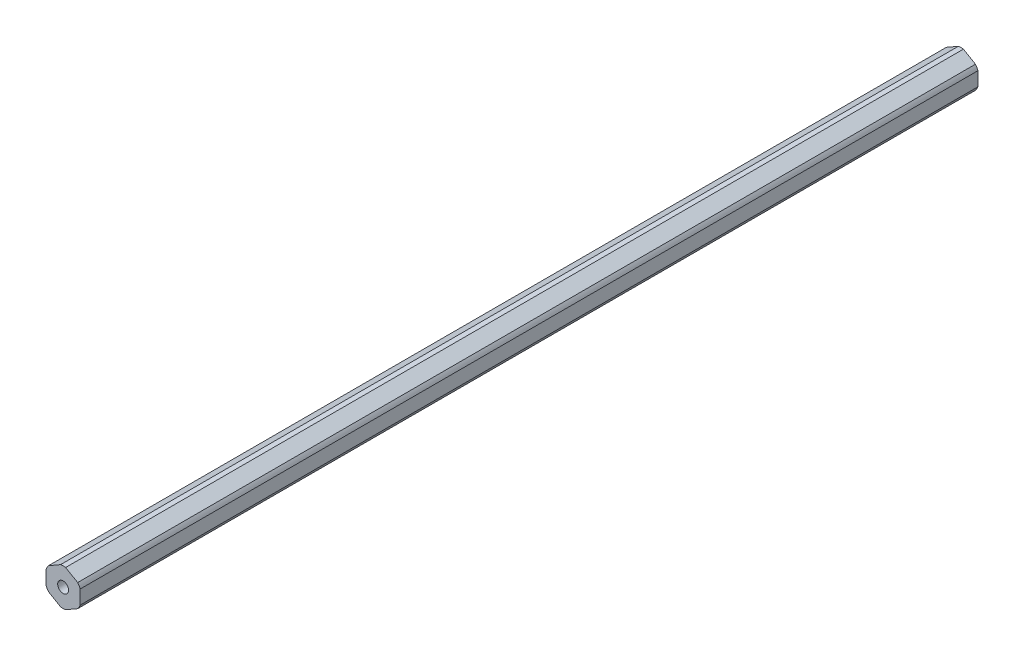
from build123d import *

# Parameters (mm, degrees)
BOSS_EXTRUDE1_DEPTH                  = 166.6875
F_10_32_TAPPED_HOLE1_D               = 4.0386
F_10_32_TAPPED_HOLE1_DEPTH           = 16.34744
F_10_32_TAPPED_HOLE1_TIP             = 1.213317848
F_10_32_TAPPED_HOLE1_ON_FACE_2_D     = 4.0386
F_10_32_TAPPED_HOLE1_ON_FACE_2_DEPTH = 16.34744
F_10_32_TAPPED_HOLE1_ON_FACE_2_TIP   = 1.213317848


with BuildPart() as part:
    # Sketch1 → Boss-Extrude1 (new, symmetric)
    with BuildSketch(Plane.XY):
        with BuildLine():
            ThreePointArc((0.93173274, 6.79441227), (0, 6.858), (-0.93173274, 6.79441227))
            Line((-0.93173274, 6.79441227), (-5.41826726, 4.204110358))
            ThreePointArc((-5.41826726, 4.204110358), (-5.939202219, 3.429), (-6.35, 2.590301913))
            Line((-6.35, 2.590301913), (-6.35, -2.590301913))
            ThreePointArc((-6.35, -2.590301913), (-5.939202219, -3.429), (-5.41826726, -4.204110358))
            Line((-5.41826726, -4.204110358), (-0.93173274, -6.79441227))
            ThreePointArc((-0.93173274, -6.79441227), (0, -6.858), (0.93173274, -6.79441227))
            Line((0.93173274, -6.79441227), (5.41826726, -4.204110358))
            ThreePointArc((5.41826726, -4.204110358), (5.939202219, -3.429), (6.35, -2.590301913))
            Line((6.35, -2.590301913), (6.35, 2.590301913))
            ThreePointArc((6.35, 2.590301913), (5.939202219, 3.429), (5.41826726, 4.204110358))
            Line((5.41826726, 4.204110358), (0.93173274, 6.79441227))
        make_face()
    extrude(amount=BOSS_EXTRUDE1_DEPTH, both=True)

    # #10-32 Tapped Hole1
    with Locations(Plane.XY.offset(166.6875)):
        with Locations((0, 0)):
            Hole(F_10_32_TAPPED_HOLE1_D / 2, depth=F_10_32_TAPPED_HOLE1_DEPTH)
            with Locations((0, 0, -(F_10_32_TAPPED_HOLE1_DEPTH + F_10_32_TAPPED_HOLE1_TIP / 2))):  # 118° drill point
                Cone(0, F_10_32_TAPPED_HOLE1_D / 2, F_10_32_TAPPED_HOLE1_TIP, mode=Mode.SUBTRACT)

    # #10-32 Tapped Hole1 on face 2
    with Locations(Plane(origin=(0, 0, -166.6875), x_dir=(-1, 0, 0), z_dir=(0, 0, -1))):
        with Locations((0, 0)):
            Hole(F_10_32_TAPPED_HOLE1_ON_FACE_2_D / 2, depth=F_10_32_TAPPED_HOLE1_ON_FACE_2_DEPTH)
            with Locations((0, 0, -(F_10_32_TAPPED_HOLE1_ON_FACE_2_DEPTH + F_10_32_TAPPED_HOLE1_ON_FACE_2_TIP / 2))):  # 118° drill point
                Cone(0, F_10_32_TAPPED_HOLE1_ON_FACE_2_D / 2, F_10_32_TAPPED_HOLE1_ON_FACE_2_TIP, mode=Mode.SUBTRACT)


solid = part.part
